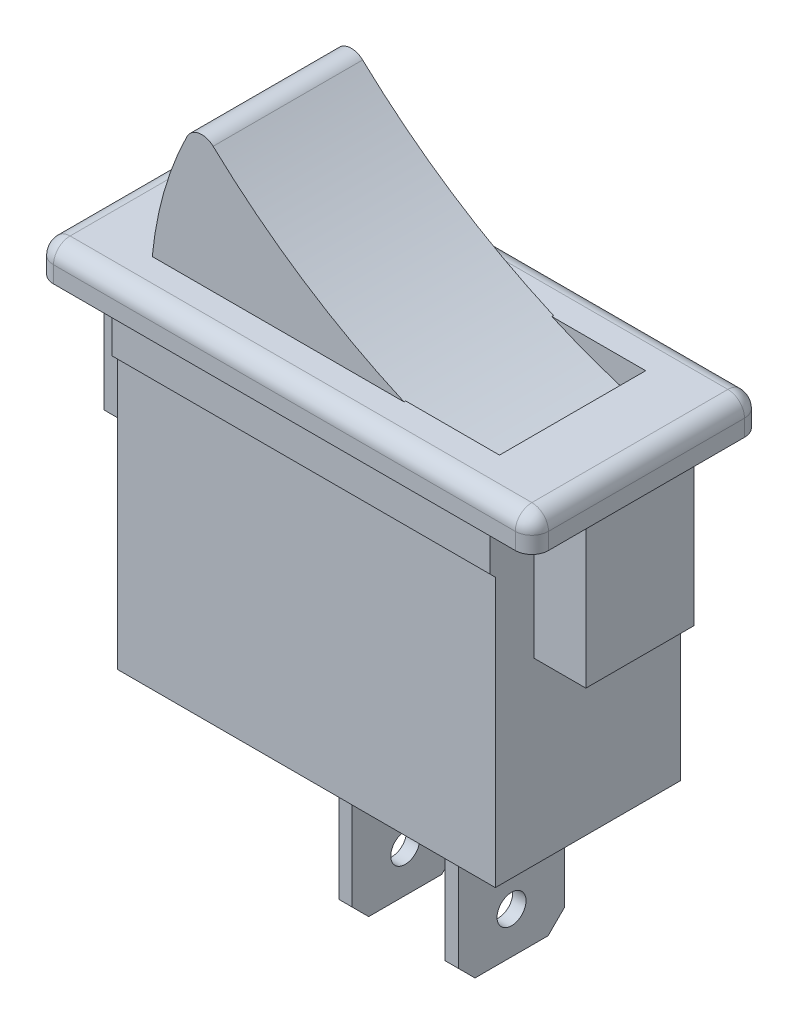
from build123d import *

# Parameters (mm, degrees)
SKETCH1_W               = 22.75
SKETCH1_H               = 11.15
BOSS_EXTRUDE1_DEPTH     = 19.5
SKETCH2_W               = 29.8
SKETCH2_H               = 13.8
SKETCH2_W_2             = 20.9
SKETCH2_H_2             = 8.8
BOSS_EXTRUDE2_DEPTH     = 2
FILLET1_R               = 1
BOSS_EXTRUDE3_DEPTH     = 4.5
FILLET2_R               = 1
SKETCH4_W               = 0.8
SKETCH4_H               = 6.4
BOSS_EXTRUDE4_DEPTH     = 8.7
CHAMFER1_SIZE           = 1
SKETCH5_W               = 29
SKETCH5_H               = 6.5
BOSS_EXTRUDE5_DEPTH     = 8.7
SKETCH6_W               = 22.75
SKETCH6_H               = 11.78
BOSS_EXTRUDE6_DEPTH     = 3.5
CHAMFER2_SIZE           = 0.5
CUT_EXTRUDE1_DEPTH      = 34.821116013
CUT_EXTRUDE1_DEPTH_BACK = 34.821116013
SKETCH7_R               = 0.871711707


with BuildPart() as part:
    # Sketch1 → Boss-Extrude1 (new body)
    with BuildSketch(Plane(origin=(0, 0, 0), x_dir=(1, 0, 0), z_dir=(0, 1, 0))):
        Rectangle(SKETCH1_W, SKETCH1_H)
    extrude(amount=BOSS_EXTRUDE1_DEPTH)

    # Sketch2 → Boss-Extrude2 (add)
    with BuildSketch(Plane(origin=(0, 19.5, 0), x_dir=(1, 0, 0), z_dir=(0, 1, 0))):
        Rectangle(SKETCH2_W, SKETCH2_H)
        Rectangle(SKETCH2_W_2, SKETCH2_H_2, mode=Mode.SUBTRACT)
    extrude(amount=BOSS_EXTRUDE2_DEPTH)

    # Fillet1
    fillet1_edges = [part.edges().sort_by_distance(p)[0] for p in [
        (14.9, 21.5, 0),
        (0, 21.5, -6.9),
        (-14.9, 21.5, 0),
        (0, 21.5, 6.9),
        (14.9, 20.5, 6.9),
        (14.9, 20.5, -6.9),
        (-14.9, 20.5, -6.9),
        (-14.9, 20.5, 6.9),
    ]]
    fillet(fillet1_edges, radius=FILLET1_R)

    # Sketch3 → Boss-Extrude3 (add, symmetric)
    with BuildSketch(Plane.XY):
        with BuildLine():
            ThreePointArc((-7.628944694, 29.986265243), (-9.732417399, 24.929551358), (-10.45, 19.5))
            Line((-10.45, 19.5), (10.45, 19.5))
            ThreePointArc((10.45, 19.5), (0.729024757, 23.568181114), (-7.628944694, 29.986265243))
        make_face()
    extrude(amount=BOSS_EXTRUDE3_DEPTH, both=True)

    # Fillet2
    fillet2_edges = [part.edges().sort_by_distance(p)[0] for p in [
        (-7.628944694, 29.986265243, 0),
    ]]
    fillet(fillet2_edges, radius=FILLET2_R)

    # Sketch4 → Boss-Extrude4 (add)
    with BuildSketch(Plane(origin=(0, 0, 0), x_dir=(-1, 0, 0), z_dir=(0, -1, 0))):
        with Locations((-6.375, 0)):
            Rectangle(SKETCH4_W, SKETCH4_H)
        with Locations((0.025, 0)):
            Rectangle(SKETCH4_W, SKETCH4_H)
    extrude(amount=BOSS_EXTRUDE4_DEPTH)

    # Chamfer1
    chamfer1_edges = [part.edges().sort_by_distance(p)[0] for p in [
        (6.375, -8.7, 3.2),
        (6.375, -8.7, -3.2),
        (-0.025, -8.7, 3.2),
        (-0.025, -8.7, -3.2),
    ]]
    chamfer(chamfer1_edges, length=CHAMFER1_SIZE)

    # Sketch5 → Boss-Extrude5 (add)
    with BuildSketch(Plane.XZ.offset(-19.5)):
        Rectangle(SKETCH5_W, SKETCH5_H)
    extrude(amount=BOSS_EXTRUDE5_DEPTH)

    # Sketch6 → Boss-Extrude6 (add)
    with BuildSketch(Plane.XZ.offset(-19.5)):
        Rectangle(SKETCH6_W, SKETCH6_H)
    extrude(amount=BOSS_EXTRUDE6_DEPTH)

    # Chamfer2
    # the kernel refuses this chamfer: 0.5 mm, written as the material it takes off along each edge
    with BuildSketch(Plane(origin=(-12.660841494, 16, -5.89), x_dir=(0, -0.027495876610585647, 0.9996219169112968), z_dir=(1, 0, 0))) as chamfer2_piece_1_section:
        Polygon((CHAMFER2_SIZE * 0.999621916911, -CHAMFER2_SIZE * 0.0274958766106), (-CHAMFER2_SIZE * 0.0274958766106, -CHAMFER2_SIZE * 0.999621916911), (0, 0), align=None)
    chamfer2_piece_1 = extrude(amount=25.321682988, mode=Mode.PRIVATE)
    chamfer2_piece_1 = split(chamfer2_piece_1, bisect_by=Plane(origin=(0, 16.184966798, -5.575), z_dir=(0, 0, -1)), keep=Keep.TOP, mode=Mode.PRIVATE)
    add(chamfer2_piece_1, mode=Mode.SUBTRACT)
    with BuildSketch(Plane(origin=(12.660841494, 16, 5.89), x_dir=(0, 0.9996219169112968, 0.02749587661058555), z_dir=(-1, 0, 0))) as chamfer2_piece_2_section:
        Polygon((CHAMFER2_SIZE * 0.999621916911, CHAMFER2_SIZE * 0.0274958766106), (-CHAMFER2_SIZE * 0.0274958766106, CHAMFER2_SIZE * 0.999621916911), (0, 0), align=None)
    chamfer2_piece_2 = extrude(amount=25.321682988, mode=Mode.PRIVATE)
    chamfer2_piece_2 = split(chamfer2_piece_2, bisect_by=Plane(origin=(0, 16.184966798, 5.575), z_dir=(0, 0, 1)), keep=Keep.TOP, mode=Mode.PRIVATE)
    add(chamfer2_piece_2, mode=Mode.SUBTRACT)

    # Sketch7 → Cut-Extrude1 (cut, two sides: drawn at the far end of the back side and taken through both)
    with BuildSketch(Plane.ZY.offset(0.425).offset(-CUT_EXTRUDE1_DEPTH_BACK)):
        with Locations((0, -6.204058817)):
            Circle(SKETCH7_R)
    extrude(amount=CUT_EXTRUDE1_DEPTH + CUT_EXTRUDE1_DEPTH_BACK, mode=Mode.SUBTRACT)


solid = part.part
